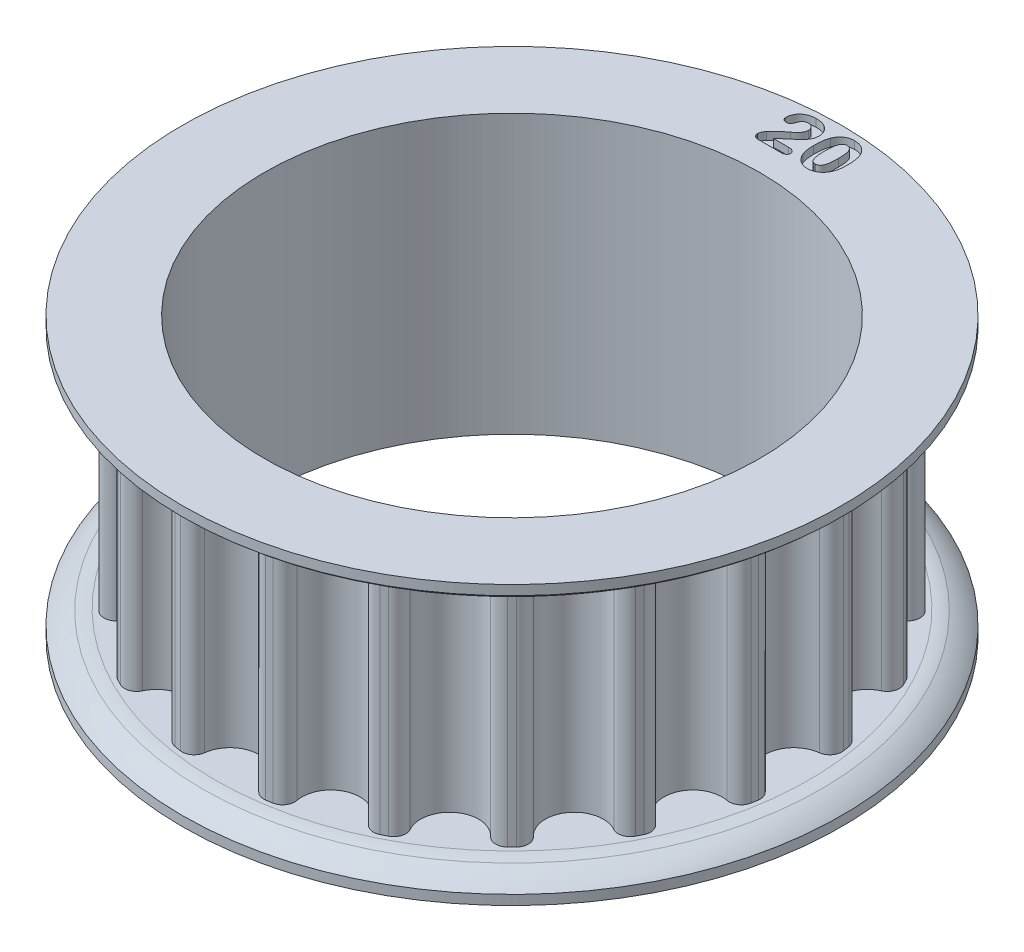
from build123d import *

# Parameters (mm, degrees)
SKETCH1_R               = 15.34399401
TOOTHOD_DEPTH           = 6.0325
TOOTHPROFILE_DEPTH      = 25.828220423
TOOTHPATTERN_COUNT      = 20
BORE_DEPTH              = 26.549391459
BORE_DEPTH_BACK         = 26.549391459
SKETCH7_R               = 13.0175
LARGE_TOOTH_COUNT_DEPTH = 0.4


with BuildPart() as part:
    # Sketch1 → ToothOD (new, symmetric)
    with BuildSketch(Plane(origin=(0, 0, 0), x_dir=(1, 0, 0), z_dir=(0, 1, 0))):
        Circle(SKETCH1_R)
    extrude(amount=TOOTHOD_DEPTH, both=True)

    # Sketch2 → ToothProfile (cut, through all)
    with BuildSketch(Plane(origin=(0, 6.0325, 0), x_dir=(1, 0, 0), z_dir=(0, 1, 0))):
        with BuildLine():
            ThreePointArc((-1.514151189, 14.627414336), (0, 13.28399401), (1.514151189, 14.627414336))
            ThreePointArc((1.514151189, 14.627414336), (1.759047929, 15.056333772), (2.237219512, 15.180019797))
            ThreePointArc((2.237219512, 15.180019797), (0, 15.34399401), (-2.237219512, 15.180019797))
            ThreePointArc((-2.237219512, 15.180019797), (-1.759047929, 15.056333772), (-1.514151189, 14.627414336))
        make_face()
    toothprofile = extrude(amount=-TOOTHPROFILE_DEPTH, mode=Mode.SUBTRACT)

    # ToothPattern: ToothProfile ×20 about axis
    toothpattern_axis = Axis((0, 6.0325, 0), (0, -1, 0))
    for i in range(1, TOOTHPATTERN_COUNT):
        add(toothprofile.rotate(toothpattern_axis, i * 360 / TOOTHPATTERN_COUNT), mode=Mode.SUBTRACT)

    # Sketch4 → Flange (revolve)
    with BuildSketch(Plane.XY):
        with BuildLine():
            Line((0, -6.0325), (15.59799401, -6.0325))
            ThreePointArc((15.59799401, -6.0325), (15.92375, -6.058122571), (16.243566338, -6.125137424))
            ThreePointArc((16.243566338, -6.125137424), (16.811294915, -6.406697125), (17.31249401, -6.7945))
            Line((17.31249401, -6.7945), (17.31249401, -7.3025))
            Line((17.31249401, -7.3025), (0, -7.3025))
            Line((0, -7.3025), (0, -6.0325))
        make_face()
        with BuildLine():
            Line((17.31249401, 7.3025), (17.31249401, 6.7945))
            ThreePointArc((17.31249401, 6.7945), (16.811294915, 6.406697125), (16.243566338, 6.125137424))
            ThreePointArc((16.243566338, 6.125137424), (15.92375, 6.058122571), (15.59799401, 6.0325))
            Line((15.59799401, 6.0325), (0, 6.0325))
            Line((0, 6.0325), (0, 7.3025))
            Line((0, 7.3025), (17.31249401, 7.3025))
        make_face()
    revolve(axis=Axis((0, 7.858125, 0), (0, -1, 0)))

    # Sketch7 → Bore (cut, two sides: drawn at the far end of the back side and taken through both)
    with BuildSketch(Plane.XZ.offset(-BORE_DEPTH_BACK)):
        Circle(SKETCH7_R)
    extrude(amount=BORE_DEPTH + BORE_DEPTH_BACK, mode=Mode.SUBTRACT)

    # Sketch9 → Large Tooth Count (cut)
    # profile 1 of 2: a face of its own
    with BuildSketch(Plane(origin=(0, 7.3025, 0), x_dir=(1, 0, 0), z_dir=(0, 1, 0))):
        with BuildLine():
            Line((-1.17475, 14.918306129), (-0.380503906, 14.918306129))
            add(Edge.make_bspline(
                [(-0.380503906, 14.918306129), (-0.355804804, 14.917682907), (-0.309030284, 14.916502664), (-0.243428178, 14.904118762), (-0.186528488, 14.883888919), (-0.139033156, 14.85562971), (-0.101393999, 14.82140095), (-0.074037597, 14.782715406), (-0.05719802, 14.739856105), (-0.055122246, 14.709761932), (-0.054074219, 14.694567848)],
                knots=[0, 0, 0, 0, 1.343135754, 2.543595783, 3.617176489, 4.61442092, 5.531765965, 6.365790276, 7.174912707, 8, 8, 8, 8], degree=3))
            add(Edge.make_bspline(
                [(-0.054074219, 14.694567848), (-0.054802085, 14.680914227), (-0.056261987, 14.653528763), (-0.069398545, 14.613617613), (-0.090815368, 14.575898238), (-0.119929687, 14.540631431), (-0.158258195, 14.509803266), (-0.207543811, 14.48879411), (-0.265920631, 14.476030606), (-0.30799964, 14.474578885), (-0.330398438, 14.473806129)],
                knots=[0, 0, 0, 0, 0.824179157, 1.653080055, 2.512971333, 3.436438535, 4.405072091, 5.457340227, 6.646533722, 8, 8, 8, 8], degree=3))
            Line((-0.330398438, 14.473806129), (-1.536898438, 14.473806129))
            add(Edge.make_bspline(
                [(-1.536898438, 14.473806129), (-1.558472167, 14.474747701), (-1.599630029, 14.476544009), (-1.658082736, 14.490418249), (-1.709286326, 14.514606965), (-1.752624345, 14.547943859), (-1.786632726, 14.588103917), (-1.811741068, 14.63229278), (-1.827332638, 14.680148984), (-1.829165097, 14.713470809), (-1.830089844, 14.730286598)],
                knots=[0, 0, 0, 0, 1.188346208, 2.267099395, 3.286301641, 4.287122075, 5.25691743, 6.166969209, 7.074964888, 8, 8, 8, 8], degree=3))
            add(Edge.make_bspline(
                [(-1.830089844, 14.730286598), (-1.82945326, 14.742077618), (-1.82809279, 14.767276672), (-1.81802838, 14.806856447), (-1.803891207, 14.850945351), (-1.783601434, 14.897581453), (-1.760792521, 14.944322087), (-1.735670977, 14.987318721), (-1.709387952, 15.025259736), (-1.689753106, 15.047140248), (-1.680269531, 15.057708473)],
                knots=[0, 0, 0, 0, 0.772497252, 1.650934469, 2.665768415, 3.807487169, 4.98083678, 6.074173258, 7.069831195, 8, 8, 8, 8], degree=3))
            add(Edge.make_bspline(
                [(-1.680269531, 15.057708473), (-1.644035421, 15.094730938), (-1.574101955, 15.166185965), (-1.470555323, 15.267208505), (-1.374109598, 15.360134187), (-1.297309351, 15.431321971), (-1.23997077, 15.483451958), (-1.20075337, 15.517962836), (-1.165078366, 15.549658695), (-1.131700628, 15.577053388), (-1.102112959, 15.602111382), (-1.075294446, 15.623421764), (-1.051577987, 15.641444775), (-1.036380199, 15.651754679), (-1.029394531, 15.656493629)],
                knots=[0, 0, 0, 0, 2.106460972, 4.065564631, 5.88232778, 7.552435621, 8.323665149, 9.033433807, 9.676767744, 10.26395234, 10.78914621, 11.253325952, 11.656791058, 12, 12, 12, 12], degree=3))
            add(Edge.make_bspline(
                [(-1.029394531, 15.656493629), (-1.008100325, 15.67169795), (-0.966690791, 15.701264859), (-0.908607017, 15.747117736), (-0.856992368, 15.79358195), (-0.81034503, 15.839192122), (-0.769506063, 15.885410695), (-0.734191479, 15.932030152), (-0.704185654, 15.978984079), (-0.679139431, 16.025994093), (-0.660078043, 16.073185347), (-0.644945306, 16.119397262), (-0.637105315, 16.165385255), (-0.635693618, 16.19572389), (-0.635, 16.210630348)],
                knots=[0, 0, 0, 0, 1.334834965, 2.595771614, 3.772830874, 4.876488071, 5.92253324, 6.916378838, 7.85720954, 8.762924605, 9.629317751, 10.451189837, 11.239014127, 12, 12, 12, 12], degree=3))
            add(Edge.make_bspline(
                [(-0.635, 16.210630348), (-0.63557668, 16.226050246), (-0.636701897, 16.256137525), (-0.645411493, 16.30007768), (-0.659757467, 16.341594223), (-0.680292652, 16.380073347), (-0.705082453, 16.415594933), (-0.734491604, 16.446994199), (-0.768185045, 16.474008719), (-0.80541105, 16.49670422), (-0.845448109, 16.515217774), (-0.88806427, 16.527943578), (-0.932491171, 16.536334234), (-0.9628789, 16.537144845), (-0.978296875, 16.537556129)],
                knots=[0, 0, 0, 0, 1.048524963, 2.045880207, 3.035079073, 4.026514865, 5.003545842, 5.974663832, 6.942844473, 7.932746918, 8.934660944, 9.934741294, 10.952139253, 12, 12, 12, 12], degree=3))
            add(Edge.make_bspline(
                [(-0.978296875, 16.537556129), (-0.992402558, 16.537188342), (-1.020219282, 16.536463056), (-1.060692036, 16.527427481), (-1.099462324, 16.514049004), (-1.136388025, 16.495029907), (-1.171419292, 16.470300207), (-1.204536992, 16.440358877), (-1.236368104, 16.405392784), (-1.254607433, 16.378719691), (-1.264046875, 16.364915504)],
                knots=[0, 0, 0, 0, 0.968576666, 1.910054901, 2.83824492, 3.784521401, 4.756498814, 5.779585462, 6.850863807, 8, 8, 8, 8], degree=3))
            add(Edge.make_bspline(
                [(-1.264046875, 16.364915504), (-1.265923225, 16.361136697), (-1.271503607, 16.349898289), (-1.279747767, 16.325746732), (-1.294286291, 16.290144695), (-1.309714662, 16.24377585), (-1.329529783, 16.193966006), (-1.352612707, 16.145900043), (-1.379353709, 16.103035228), (-1.406692224, 16.06309583), (-1.442160272, 16.030136185), (-1.487192125, 16.00725067), (-1.541277164, 15.993950025), (-1.580142304, 15.992582957), (-1.600894531, 15.991853004)],
                knots=[0, 0, 0, 0, 0.277128514, 0.824197545, 1.674066046, 2.805212172, 4.034469565, 5.196326461, 6.303667431, 7.353778336, 8.369399301, 9.448751033, 10.637748383, 12, 12, 12, 12], degree=3))
            add(Edge.make_bspline(
                [(-1.600894531, 15.991853004), (-1.616180684, 15.99259299), (-1.646086916, 15.994040719), (-1.68905495, 16.006073427), (-1.727403458, 16.027127402), (-1.761350035, 16.054956975), (-1.789657559, 16.089748814), (-1.808718746, 16.131489991), (-1.821206006, 16.1779962), (-1.822480726, 16.210873124), (-1.823144531, 16.227993629)],
                knots=[0, 0, 0, 0, 1.006577142, 1.969294067, 2.910545259, 3.870728958, 4.847838899, 5.837573602, 6.873926541, 8, 8, 8, 8], degree=3))
            add(Edge.make_bspline(
                [(-1.823144531, 16.227993629), (-1.822436115, 16.248538841), (-1.821005637, 16.290025035), (-1.810431458, 16.352630607), (-1.794110349, 16.416281427), (-1.770911294, 16.480516181), (-1.740660207, 16.543530658), (-1.704619525, 16.604649314), (-1.660645532, 16.661587262), (-1.611959456, 16.716617549), (-1.555478935, 16.766798642), (-1.491996993, 16.812241117), (-1.421387058, 16.852186284), (-1.34403892, 16.887246276), (-1.259686643, 16.915535948), (-1.168395357, 16.935570638), (-1.07060184, 16.948364376), (-1.003143515, 16.949645717), (-0.968375, 16.950306129)],
                knots=[0, 0, 0, 0, 0.79066067, 1.596552158, 2.438066046, 3.318094126, 4.22076533, 5.12585777, 6.043865989, 6.985993145, 7.950839248, 8.945468985, 9.986194989, 11.068910188, 12.21037173, 13.404260134, 14.66213667, 16, 16, 16, 16], degree=3))
            add(Edge.make_bspline(
                [(-0.968375, 16.950306129), (-0.94620917, 16.950002663), (-0.902834011, 16.949408825), (-0.839122333, 16.945278577), (-0.778137309, 16.939154316), (-0.719915766, 16.929476196), (-0.66430709, 16.917922285), (-0.611582715, 16.902744768), (-0.561396312, 16.885744397), (-0.529574805, 16.871815781), (-0.513953125, 16.864978004)],
                knots=[0, 0, 0, 0, 1.141710532, 2.234153931, 3.287715026, 4.297387598, 5.273071892, 6.211454997, 7.121975032, 8, 8, 8, 8], degree=3))
            add(Edge.make_bspline(
                [(-0.513953125, 16.864978004), (-0.491896335, 16.854149952), (-0.448534873, 16.832863075), (-0.388351733, 16.794251079), (-0.333414408, 16.751706434), (-0.284744221, 16.704257082), (-0.241572543, 16.653370063), (-0.202858126, 16.599839334), (-0.170697232, 16.542171962), (-0.143498456, 16.482138415), (-0.122200371, 16.420139983), (-0.106821368, 16.357390392), (-0.096837838, 16.29412865), (-0.095778904, 16.251677233), (-0.09525, 16.230474098)],
                knots=[0, 0, 0, 0, 1.100471427, 2.163417708, 3.198242748, 4.209796447, 5.203380146, 6.186404149, 7.165424876, 8.157237974, 9.136931722, 10.098602738, 11.050312444, 12, 12, 12, 12], degree=3))
            add(Edge.make_bspline(
                [(-0.09525, 16.230474098), (-0.096462028, 16.197141175), (-0.098858892, 16.131223173), (-0.118864267, 16.034457512), (-0.151758446, 15.942029698), (-0.197278591, 15.855719123), (-0.248999823, 15.776702812), (-0.301239177, 15.704620585), (-0.355006619, 15.642557968), (-0.401386401, 15.596248496), (-0.441284775, 15.561653539), (-0.47465706, 15.532680027), (-0.512217664, 15.500623943), (-0.554096375, 15.465086342), (-0.600705101, 15.42675813), (-0.651145912, 15.384362227), (-0.706225706, 15.339431932), (-0.764070622, 15.292302698), (-0.82203457, 15.245004728), (-0.876250701, 15.198275543), (-0.926555501, 15.154861339), (-0.971965666, 15.113417914), (-1.012777395, 15.074343396), (-1.049949883, 15.038386386), (-1.081487811, 15.003932987), (-1.101026322, 14.981830887), (-1.110257813, 14.97138816)],
                knots=[0, 0, 0, 0, 1.436599664, 2.840968415, 4.241909903, 5.655071448, 7.037977016, 8.313294046, 9.491515882, 10.57584574, 11.13676856, 11.768818006, 12.482089669, 13.266552005, 14.137751607, 15.08474532, 16.108481255, 17.203478555, 18.302996106, 19.33499709, 20.290440541, 21.168908746, 21.986178864, 22.727567017, 23.398805086, 24, 24, 24, 24], degree=3))
            add(Edge.make_bspline(
                [(-1.110257813, 14.97138816), (-1.119582693, 14.961971916), (-1.139268779, 14.94209295), (-1.162515013, 14.926508537), (-1.17475, 14.918306129)],
                knots=[0, 0, 0, 0, 0.947357495, 2, 2, 2, 2], degree=3))
        make_face()
    # profile 2 of 2: a face of its own
    with BuildSketch(Plane(origin=(0, 7.3025, 0), x_dir=(1, 0, 0), z_dir=(0, 1, 0))):
        with BuildLine():
            add(Edge.make_bspline(
                [(1.9685, 15.683282692), (1.968131371, 15.641273981), (1.967419837, 15.560187976), (1.961655571, 15.442983576), (1.951207455, 15.334741408), (1.937179815, 15.23422277), (1.917010565, 15.13942247), (1.888059259, 15.048737839), (1.853079058, 14.959877504), (1.822582907, 14.903800597), (1.807269531, 14.875642067)],
                knots=[0, 0, 0, 0, 1.209497071, 2.334594061, 3.377342342, 4.33954254, 5.255688756, 6.163732602, 7.077934351, 8, 8, 8, 8], degree=3))
            add(Edge.make_bspline(
                [(1.807269531, 14.875642067), (1.787936478, 14.843797623), (1.749577487, 14.7806146), (1.677385033, 14.696594912), (1.595961787, 14.621624073), (1.519497546, 14.568844191), (1.454560247, 14.531728468), (1.403667836, 14.50803127), (1.35159282, 14.487404611), (1.297529159, 14.471321527), (1.242366065, 14.457524758), (1.185214459, 14.448928721), (1.126744026, 14.443258885), (1.087120608, 14.442459888), (1.067097656, 14.442056129)],
                knots=[0, 0, 0, 0, 1.487283955, 2.95094168, 4.41101127, 5.902125695, 6.654118988, 7.399426985, 8.144676331, 8.891302758, 9.652998846, 10.416042334, 11.199576701, 12, 12, 12, 12], degree=3))
            add(Edge.make_bspline(
                [(1.067097656, 14.442056129), (1.045580061, 14.442550014), (1.003094112, 14.443525178), (0.940262957, 14.450766186), (0.879136095, 14.461909922), (0.81959525, 14.478523023), (0.761970169, 14.499826679), (0.705765385, 14.525236212), (0.651542233, 14.555675196), (0.599254365, 14.590840253), (0.549239708, 14.629847484), (0.502294332, 14.672803785), (0.458807978, 14.719357936), (0.418322787, 14.769510113), (0.380683364, 14.822664504), (0.346823209, 14.879869593), (0.31595646, 14.94034506), (0.298214497, 14.982676343), (0.289222656, 15.004130348)],
                knots=[0, 0, 0, 0, 1.009932548, 1.99408639, 2.965482085, 3.924138432, 4.89180467, 5.847155024, 6.816812091, 7.807222536, 8.802640221, 9.791680656, 10.791266951, 11.79028034, 12.815463044, 13.845922674, 14.908287616, 16, 16, 16, 16], degree=3))
            add(Edge.make_bspline(
                [(0.289222656, 15.004130348), (0.281059895, 15.027537853), (0.264519225, 15.074969822), (0.243605819, 15.148419577), (0.227073491, 15.225069788), (0.212983878, 15.304625732), (0.202606696, 15.387582472), (0.19605197, 15.474016009), (0.191268888, 15.563836381), (0.190759424, 15.624902274), (0.1905, 15.655997535)],
                knots=[0, 0, 0, 0, 0.897562942, 1.818783213, 2.76314425, 3.735786263, 4.743659685, 5.788940996, 6.87411031, 8, 8, 8, 8], degree=3))
            add(Edge.make_bspline(
                [(0.1905, 15.655997535), (0.190719249, 15.695856753), (0.191146104, 15.773458434), (0.196363528, 15.886609305), (0.204004582, 15.99352914), (0.215365183, 16.094161953), (0.229982614, 16.188605611), (0.248703807, 16.276429732), (0.271358306, 16.357831528), (0.290059118, 16.409008994), (0.299144531, 16.433872535)],
                knots=[0, 0, 0, 0, 1.211213093, 2.3581038, 3.441550622, 4.468232003, 5.434885287, 6.344647653, 7.195780392, 8, 8, 8, 8], degree=3))
            add(Edge.make_bspline(
                [(0.299144531, 16.433872535), (0.30779743, 16.454340534), (0.324862766, 16.494707727), (0.354814153, 16.552074369), (0.386933398, 16.605998806), (0.422399313, 16.655823978), (0.460679426, 16.702101628), (0.501810532, 16.744911577), (0.546067837, 16.783604623), (0.593045585, 16.818544317), (0.642370765, 16.849759733), (0.69438894, 16.876628243), (0.748527574, 16.89965789), (0.805242977, 16.917794374), (0.86391853, 16.93226255), (0.924763009, 16.94259396), (0.987900408, 16.949352244), (1.030864973, 16.949984599), (1.052710938, 16.950306129)],
                knots=[0, 0, 0, 0, 1.092131274, 2.153912383, 3.178725518, 4.175816426, 5.157440891, 6.129150557, 7.091289863, 8.044144258, 9.005046174, 9.957761821, 10.919626289, 11.894053079, 12.881953399, 13.888413684, 14.926332911, 16, 16, 16, 16], degree=3))
            add(Edge.make_bspline(
                [(1.052710938, 16.950306129), (1.082997065, 16.949451905), (1.142609502, 16.94777053), (1.229997826, 16.937270071), (1.313019784, 16.917322421), (1.392007617, 16.891257291), (1.466419206, 16.85820121), (1.53542776, 16.818051437), (1.599268851, 16.772052483), (1.656927571, 16.71889382), (1.709382369, 16.66055), (1.758029037, 16.597995325), (1.80069487, 16.529818806), (1.824851643, 16.481538968), (1.837035156, 16.457188942)],
                knots=[0, 0, 0, 0, 1.109558041, 2.183952366, 3.216854429, 4.23207455, 5.227199793, 6.193422057, 7.151808797, 8.103645573, 9.059962693, 10.023161255, 11.002977682, 12, 12, 12, 12], degree=3))
            add(Edge.make_bspline(
                [(1.837035156, 16.457188942), (1.847639716, 16.432689468), (1.869402768, 16.382410783), (1.896216677, 16.301818211), (1.917898294, 16.214591474), (1.937108174, 16.12100082), (1.951231324, 16.02091897), (1.96077174, 15.914108764), (1.96760705, 15.80094484), (1.96819747, 15.72314646), (1.9685, 15.683282692)],
                knots=[0, 0, 0, 0, 0.809925716, 1.662158126, 2.573846796, 3.536425161, 4.560577216, 5.639238755, 6.790349635, 8, 8, 8, 8], degree=3))
        make_face()
        with BuildLine():
            add(Edge.make_bspline(
                [(1.42875, 15.715528785), (1.428514842, 15.761181941), (1.428066367, 15.848248034), (1.420805113, 15.97201647), (1.410653214, 16.082575549), (1.394789196, 16.179856468), (1.374905619, 16.265034837), (1.349616981, 16.338637642), (1.317965124, 16.400547592), (1.28028632, 16.451200243), (1.235842262, 16.490782567), (1.183335534, 16.518044346), (1.123843, 16.534789315), (1.081600193, 16.53661022), (1.05965625, 16.537556129)],
                knots=[0, 0, 0, 0, 1.633225856, 3.114759359, 4.434737241, 5.603958002, 6.638665035, 7.561259479, 8.381657746, 9.116540784, 9.808409139, 10.491288005, 11.216266797, 12, 12, 12, 12], degree=3))
            add(Edge.make_bspline(
                [(1.05965625, 16.537556129), (1.045866363, 16.537072511), (1.018934033, 16.536127982), (0.980107849, 16.526101256), (0.944032536, 16.510922983), (0.911068769, 16.488712986), (0.880716111, 16.460984723), (0.853924175, 16.426433075), (0.82941747, 16.386446183), (0.808087275, 16.339781068), (0.790108673, 16.286096747), (0.773456194, 16.225412118), (0.760758846, 16.156791538), (0.749004487, 16.080915526), (0.741161559, 15.997238829), (0.734385375, 15.905961394), (0.731339252, 15.806829584), (0.730621668, 15.738184593), (0.73025, 15.702630348)],
                knots=[0, 0, 0, 0, 0.669696571, 1.307950517, 1.938804908, 2.566004229, 3.232404648, 3.931206197, 4.686184023, 5.510742519, 6.421868267, 7.438963062, 8.570593107, 9.815715711, 11.174622422, 12.659078161, 14.269590381, 16, 16, 16, 16], degree=3))
            add(Edge.make_bspline(
                [(0.73025, 15.702630348), (0.730273986, 15.677823097), (0.730320688, 15.629522855), (0.732740556, 15.558923915), (0.734761379, 15.491909322), (0.738974887, 15.428583566), (0.743604859, 15.368821206), (0.750444012, 15.312828683), (0.7569121, 15.260276606), (0.768034456, 15.197220861), (0.78397586, 15.126389144), (0.808874532, 15.051294239), (0.838903996, 14.988979142), (0.873777695, 14.938720965), (0.914497099, 14.901048208), (0.959565792, 14.873737646), (1.009870691, 14.858055119), (1.04483453, 14.855902113), (1.062632813, 14.854806129)],
                knots=[0, 0, 0, 0, 1.189567988, 2.316114014, 3.387435446, 4.404491543, 5.359423352, 6.261455326, 7.109364759, 7.898138353, 9.331238373, 10.587655566, 11.683555581, 12.638619096, 13.502837386, 14.324300788, 15.146988201, 16, 16, 16, 16], degree=3))
            add(Edge.make_bspline(
                [(1.062632813, 14.854806129), (1.084743394, 14.855891317), (1.127232837, 14.857976701), (1.187339591, 14.875555507), (1.23940512, 14.905842614), (1.284183542, 14.94770491), (1.320723092, 15.001933765), (1.35190648, 15.06645811), (1.376805186, 15.142279773), (1.39275605, 15.212723178), (1.402836384, 15.27505721), (1.409819199, 15.326832697), (1.415626766, 15.382260685), (1.420802797, 15.441452804), (1.423831351, 15.504514023), (1.427183332, 15.571464864), (1.428425556, 15.642267725), (1.42864015, 15.690724141), (1.42875, 15.715528785)],
                knots=[0, 0, 0, 0, 1.019311246, 1.958789202, 2.858219583, 3.776338343, 4.763092182, 5.858898013, 7.075444102, 8.438226515, 9.188631206, 9.989622347, 10.849409984, 11.760937118, 12.731798053, 13.763268738, 14.855026274, 16, 16, 16, 16], degree=3))
        make_face(mode=Mode.SUBTRACT)
    extrude(amount=-LARGE_TOOTH_COUNT_DEPTH, mode=Mode.SUBTRACT)


solid = part.part
